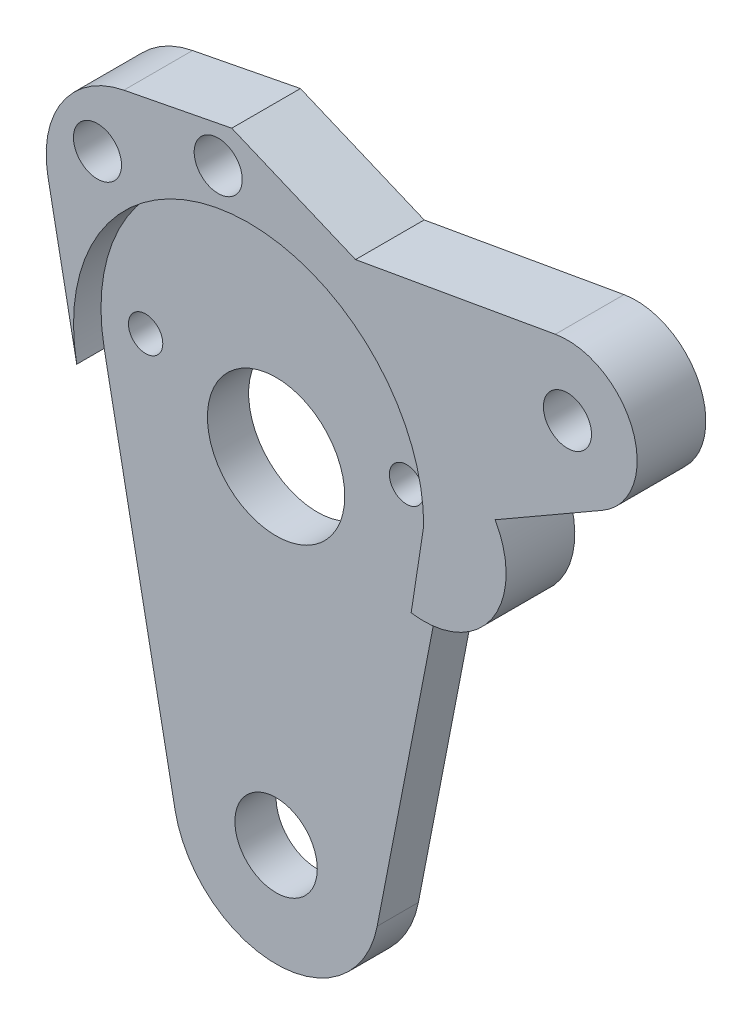
from build123d import *

# Parameters (mm, degrees)
SKETCH1_R           = 3
SKETCH1_R_2         = 5
SKETCH1_R_3         = 1.25
BOSS_EXTRUDE1_DEPTH = 3
SKETCH2_R           = 1.75
BOSS_EXTRUDE2_DEPTH = 5
SKETCH4_R           = 1.75
BOSS_EXTRUDE3_DEPTH = 5
BOSS_EXTRUDE4_DEPTH = 5


with BuildPart() as part:
    # Sketch1 → Boss-Extrude1 (new body)
    with BuildSketch(Plane.XY):
        with BuildLine():
            Line((-7.362057912, -28.931818182), (-12.51549845, -2.434090909))
            ThreePointArc((-12.51549845, -2.434090909), (0, 12.75), (12.51549845, -2.434090909))
            Line((12.51549845, -2.434090909), (7.362057912, -28.931818182))
            ThreePointArc((7.362057912, -28.931818182), (0, -35), (-7.362057912, -28.931818182))
        make_face()
        with Locations((0, -27.5)):
            Circle(SKETCH1_R, mode=Mode.SUBTRACT)
        with Locations((0, -3)):
            Circle(SKETCH1_R_2, mode=Mode.SUBTRACT)
        with Locations((-9.5, 0)):
            Circle(SKETCH1_R_3, mode=Mode.SUBTRACT)
        with Locations((9.5, 0)):
            Circle(SKETCH1_R_3, mode=Mode.SUBTRACT)
    extrude(amount=BOSS_EXTRUDE1_DEPTH)

    # Sketch2 → Boss-Extrude2 (add)
    with BuildSketch(Plane.XY):
        with BuildLine():
            Line((-2.214014265, 12.556298851), (22.333416551, 16.884673211))
            ThreePointArc((22.333416551, 16.884673211), (27.986397612, 13.618876906), (25.748516278, 7.485891702))
            Line((25.748516278, 7.485891702), (12.75, 0))
            ThreePointArc((12.75, 0), (8.195542024, 9.76706665), (-2.214014265, 12.556298851))
        make_face()
        with Locations((23.214967202, 11.885151032)):
            Circle(SKETCH2_R, mode=Mode.SUBTRACT)
    extrude(amount=BOSS_EXTRUDE2_DEPTH)

    # Sketch4 → Boss-Extrude3 (add)
    with BuildSketch(Plane.XY):
        with BuildLine():
            Line((-12.51549845, -2.434090909), (-14.61549845, 8.363594028))
            ThreePointArc((-14.61549845, 8.363594028), (-13.547906523, 13.61371621), (-9.080608035, 16.571211715))
            Line((-9.080608035, 16.571211715), (-1.227746263, 18.098484442))
            Line((-1.227746263, 18.098484442), (7.785985735, 14.319568658))
            Line((7.785985735, 14.319568658), (-2.214014265, 12.556298851))
            ThreePointArc((-2.214014265, 12.556298851), (-10.507977089, 7.221143781), (-12.51549845, -2.434090909))
        make_face()
        with Locations((-11.005882474, 11.750641074)):
            Circle(SKETCH4_R, mode=Mode.SUBTRACT)
        with Locations((-2.214014265, 15.234848079)):
            Circle(SKETCH4_R, mode=Mode.SUBTRACT)
    extrude(amount=BOSS_EXTRUDE3_DEPTH)

    # Sketch5 → Boss-Extrude4 (add)
    with BuildSketch(Plane.XY):
        with BuildLine():
            Line((12.75, 0), (11.835609178, -5.929914791))
            ThreePointArc((11.835609178, -5.929914791), (17.699847996, -3.391018256), (17.949406511, 2.994356681))
            Line((17.949406511, 2.994356681), (12.75, 0))
        make_face()
    extrude(amount=BOSS_EXTRUDE4_DEPTH)


solid = part.part
